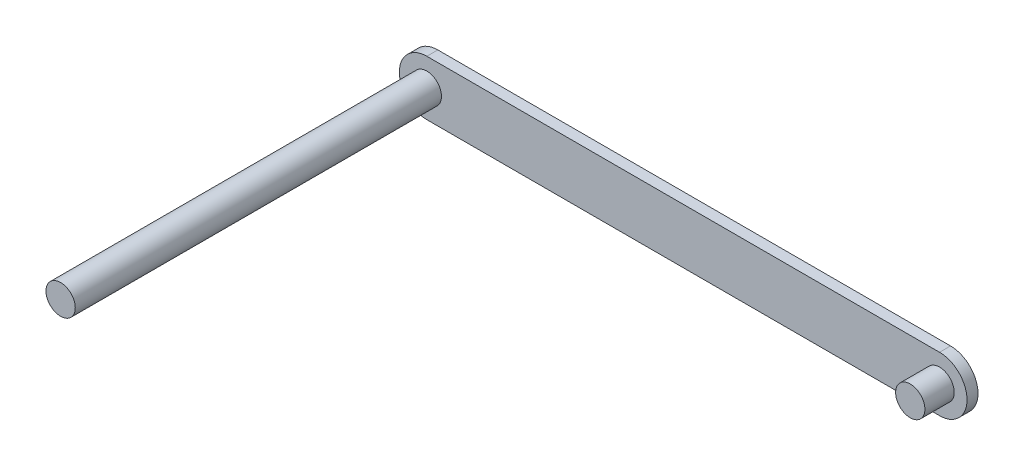
from build123d import *

# Parameters (mm, degrees)
BOSS_EXTRUDE1_DEPTH = 3
SKETCH2_R           = 4
BOSS_EXTRUDE2_DEPTH = 8
SKETCH3_R           = 4
BOSS_EXTRUDE3_DEPTH = 92


with BuildPart() as part:
    # Sketch1 → Boss-Extrude1 (new body)
    with BuildSketch(Plane.XY):
        with BuildLine():
            Line((0, 7.5), (140, 7.5))
            ThreePointArc((140, 7.5), (147.5, 0), (140, -7.5))
            Line((140, -7.5), (0, -7.5))
            ThreePointArc((0, -7.5), (-7.5, 0), (0, 7.5))
        make_face()
    extrude(amount=BOSS_EXTRUDE1_DEPTH)

    # Sketch2 → Boss-Extrude2 (add)
    with BuildSketch(Plane.XY.offset(3)):
        Circle(SKETCH2_R)
        with Locations((140, 0)):
            Circle(SKETCH2_R)
    extrude(amount=BOSS_EXTRUDE2_DEPTH)

    # Sketch3 → Boss-Extrude3 (add)
    with BuildSketch(Plane.XY.offset(11)):
        Circle(SKETCH3_R)
    extrude(amount=BOSS_EXTRUDE3_DEPTH)


solid = part.part
